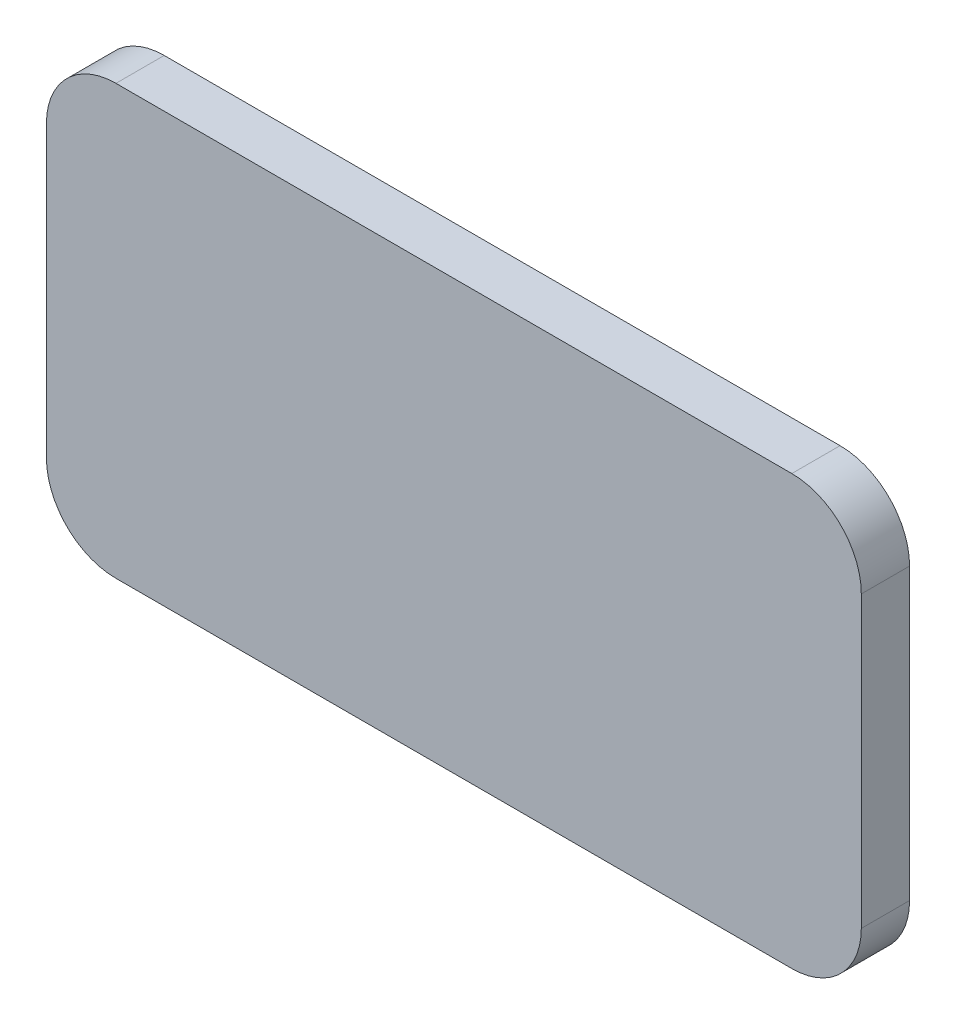
from build123d import *

# Parameters (mm, degrees)
EXTRUDE_1_DEPTH = 5


with BuildPart() as part:
    # Эскиз1 → Бобышка-Вытянуть1 (new body)
    with BuildSketch(Plane.XY):
        with BuildLine():
            Line((42.2, -15), (42.2, 15))
            ThreePointArc((42.2, 15), (40.091168825, 20.091168825), (35, 22.2))
            Line((35, 22.2), (-35, 22.2))
            ThreePointArc((-35, 22.2), (-40.091168825, 20.091168825), (-42.2, 15))
            Line((-42.2, 15), (-42.2, -15))
            ThreePointArc((-42.2, -15), (-40.091168825, -20.091168825), (-35, -22.2))
            Line((-35, -22.2), (35, -22.2))
            ThreePointArc((35, -22.2), (40.091168825, -20.091168825), (42.2, -15))
        make_face()
    extrude(amount=EXTRUDE_1_DEPTH)


solid = part.part
